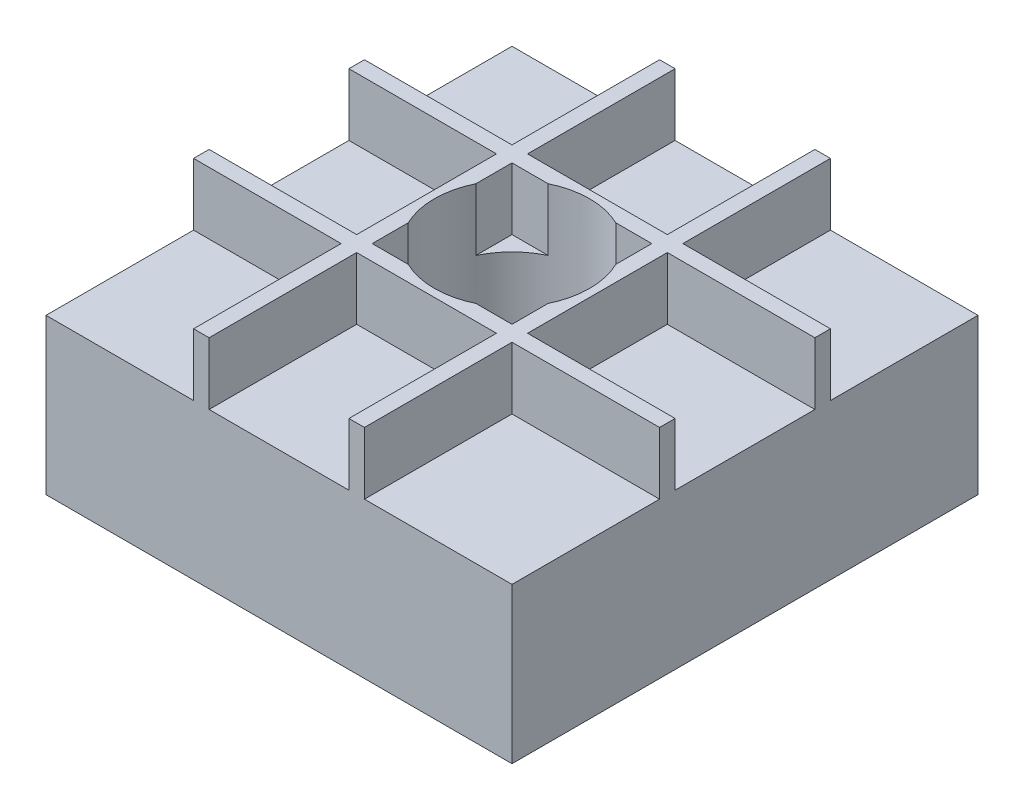
from build123d import *

# Parameters (mm, degrees)
SKETCH1_W                   = 30
SKETCH1_H                   = 30
BOSS_EXTRUDE1_DEPTH         = 5
SKETCH2_W                   = 1
SKETCH2_H                   = 30
BOSS_EXTRUDE2_DEPTH         = 4
LPATTERN1_COUNT             = 2
LPATTERN1_PITCH             = 10
CIRPATTERN1_COUNT           = 2
CIRPATTERN1_ANGLE           = 90
CIRPATTERN1_COPY_1_SKETCH_W = 1
CIRPATTERN1_COPY_1_SKETCH_H = 30
CIRPATTERN1_COPY_1_DEPTH    = 4
CUT_EXTRUDE2_DEPTH          = 22.794494718
CUT_EXTRUDE2_DEPTH_BACK     = 22.794494718
SKETCH4_R                   = 5
SKETCH8_W                   = 30
SKETCH8_H                   = 30
BOSS_EXTRUDE3_DEPTH         = 5
CUT_EXTRUDE3_DEPTH          = 5


# Read off the part's stored shape, not the designer's step: Cut-Extrude3
with BuildPart() as part:
    # Sketch1 → Boss-Extrude1 (new body)
    with BuildSketch(Plane(origin=(0, 0, 0), x_dir=(1, 0, 0), z_dir=(0, 1, 0))):
        Rectangle(SKETCH1_W, SKETCH1_H)
    extrude(amount=BOSS_EXTRUDE1_DEPTH)

    # Sketch2 → Boss-Extrude2 (add)
    with BuildSketch(Plane(origin=(0, 5, 0), x_dir=(1, 0, 0), z_dir=(0, 1, 0))):
        with Locations((-5, 0)):
            Rectangle(SKETCH2_W, SKETCH2_H)
    boss_extrude2 = extrude(amount=BOSS_EXTRUDE2_DEPTH)

    # LPattern1: Boss-Extrude2 ×2
    with Locations(*[(i * LPATTERN1_PITCH, 0, 0) for i in range(1, LPATTERN1_COUNT)]):
        add(boss_extrude2)

    # CirPattern1: Boss-Extrude2 ×2 about axis
    cirpattern1_axis = Axis((0, 5, 0), (0, 1, 0))
    for i in range(1, CIRPATTERN1_COUNT):
        add(boss_extrude2.rotate(cirpattern1_axis, i * CIRPATTERN1_ANGLE / (CIRPATTERN1_COUNT - 1)))

    # CirPattern1 copy 1 sketch → CirPattern1 copy 1 (add)
    with BuildSketch(Plane(origin=(0, 5, -10), x_dir=(0, 0, -1), z_dir=(0, 1, 0))):
        with Locations((-5, 0)):
            Rectangle(CIRPATTERN1_COPY_1_SKETCH_W, CIRPATTERN1_COPY_1_SKETCH_H)
    extrude(amount=CIRPATTERN1_COPY_1_DEPTH)

    # Sketch4 → Cut-Extrude2 (cut, two sides: drawn at the far end of the back side and taken through both)
    with BuildSketch(Plane(origin=(0, 5, 0), x_dir=(1, 0, 0), z_dir=(0, 1, 0)).offset(-CUT_EXTRUDE2_DEPTH_BACK)):
        with Locations(Location((0, 0, 0), (0, 0, 270))):
            Circle(SKETCH4_R)
    extrude(amount=CUT_EXTRUDE2_DEPTH + CUT_EXTRUDE2_DEPTH_BACK, mode=Mode.SUBTRACT)

    # Sketch8 → Boss-Extrude3 (add)
    with BuildSketch(Plane.XZ):
        Rectangle(SKETCH8_W, SKETCH8_H)
    extrude(amount=BOSS_EXTRUDE3_DEPTH)

    # Cut-Extrude3 outline → Cut-Extrude3 (cut)
    with BuildSketch(Plane.XZ):
        with BuildLine():
            ThreePointArc((7.62, 8.626), (7.173630735, 9.703630735), (6.096, 10.15))
            Line((6.096, 10.15), (-6.096, 10.15))
            ThreePointArc((-6.096, 10.15), (-7.173630735, 9.703630735), (-7.62, 8.626))
            Line((-7.62, 8.626), (-7.62, -8.626))
            ThreePointArc((-7.62, -8.626), (-7.173630735, -9.703630735), (-6.096, -10.15))
            Line((-6.096, -10.15), (6.096, -10.15))
            ThreePointArc((6.096, -10.15), (7.173630735, -9.703630735), (7.62, -8.626))
            Line((7.62, -8.626), (7.62, 8.626))
        make_face()
    extrude(amount=CUT_EXTRUDE3_DEPTH, mode=Mode.SUBTRACT)


solid = part.part
